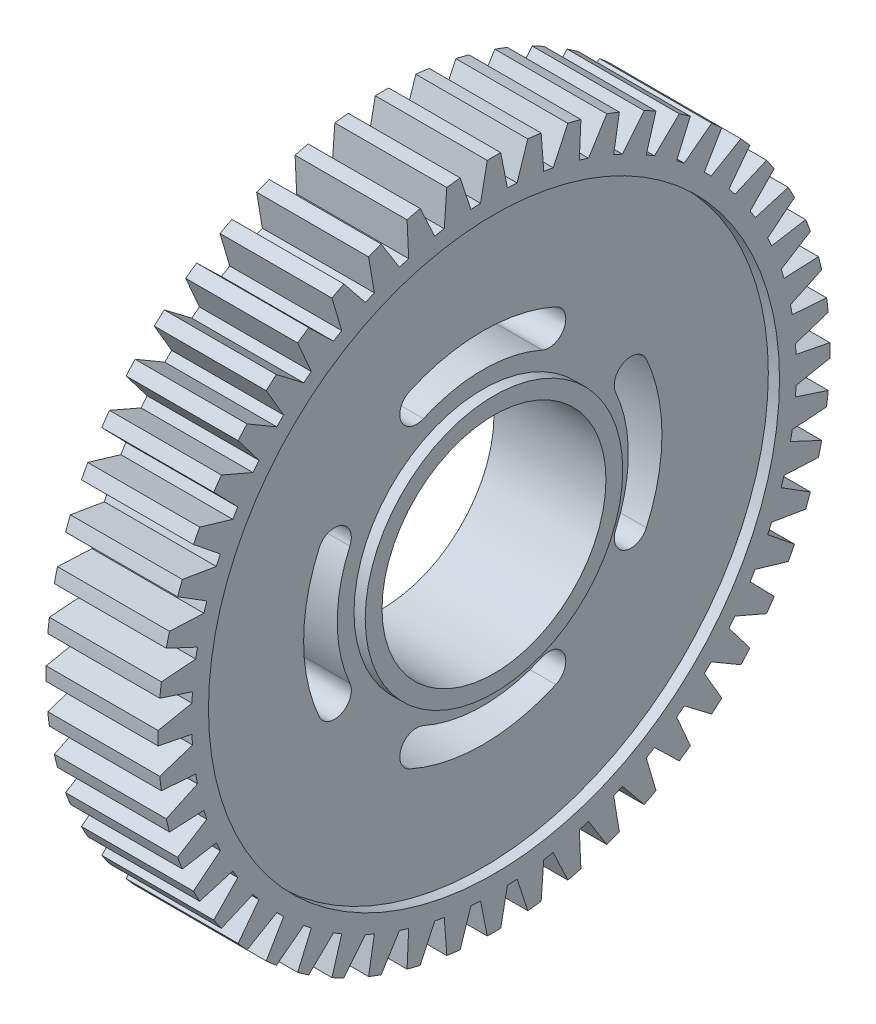
from build123d import *

# Parameters (mm, degrees)
SKETCH1_R           = 27
SKETCH1_R_2         = 11.5
BOSS_EXTRUDE1_DEPTH = 4
SKETCH1_3_R         = 27
SKETCH1_3_R_2       = 25.5
SKETCH1_3_R_3       = 11.5
SKETCH1_3_R_4       = 10
BOSS_EXTRUDE2_DEPTH = 5
BOSS_EXTRUDE3_DEPTH = 5
CIRPATTERN1_COUNT   = 52
CUT_EXTRUDE2_DEPTH  = 43.720018727
FILLET1_START       = -4
FILLET1_DEPTH       = 8
FILLET2_START       = -4
FILLET2_DEPTH       = 8
CIRPATTERN2_COUNT   = 4


with BuildPart() as part:
    # Sketch1 → Boss-Extrude1 (new, symmetric)
    with BuildSketch(Plane.YZ):
        with Locations(Location((0, 0, 0), (0, 0, 270))):
            Circle(SKETCH1_R)
        with Locations(Location((0, 0, 0), (0, 0, 270))):
            Circle(SKETCH1_R_2, mode=Mode.SUBTRACT)
    extrude(amount=BOSS_EXTRUDE1_DEPTH, both=True)

    # Sketch1<3> → Boss-Extrude2 (add, symmetric)
    # profile 1 of 2: a face of its own
    with BuildSketch(Plane.YZ):
        with Locations(Location((0, 0, 0), (0, 0, 270))):
            Circle(SKETCH1_3_R)
        with Locations(Location((0, 0, 0), (0, 0, 270))):
            Circle(SKETCH1_3_R_2, mode=Mode.SUBTRACT)
    # profile 2 of 2: a face of its own
    with BuildSketch(Plane.YZ):
        with Locations(Location((0, 0, 0), (0, 0, 270))):
            Circle(SKETCH1_3_R_3)
        with Locations(Location((0, 0, 0), (0, 0, 270))):
            Circle(SKETCH1_3_R_4, mode=Mode.SUBTRACT)
    extrude(amount=BOSS_EXTRUDE2_DEPTH, both=True)

    # Sketch1<4> → Boss-Extrude3 (add, symmetric)
    with BuildSketch(Plane.YZ):
        with BuildLine():
            ThreePointArc((29.993975486, -0.601194282), (29.998493834, -0.300612233), (30, 0))
            ThreePointArc((30, 0), (29.998493834, 0.300612233), (29.993975486, 0.601194282))
            Line((29.993975486, 0.601194282), (26.973320152, 1.2))
            ThreePointArc((26.973320152, 1.2), (26.993329214, 0.600148276), (27, 0))
            ThreePointArc((27, 0), (26.993329214, -0.600148276), (26.973320152, -1.2))
            Line((26.973320152, -1.2), (29.993975486, -0.601194282))
        make_face()
    boss_extrude3 = extrude(amount=BOSS_EXTRUDE3_DEPTH, both=True)

    # CirPattern1: Boss-Extrude3 ×52 about axis
    cirpattern1_axis = Axis((0, 0, 0), (1, 0, 0))
    for i in range(1, CIRPATTERN1_COUNT):
        add(boss_extrude3.rotate(cirpattern1_axis, i * 360 / CIRPATTERN1_COUNT))

    # Sketch1<6> → Cut-Extrude2 (cut, symmetric)
    with BuildSketch(Plane.YZ):
        with BuildLine():
            ThreePointArc((-6.5, 11.258330249), (0, 13), (6.5, 11.258330249))
            Line((6.5, 11.258330249), (8, 13.856406461))
            ThreePointArc((8, 13.856406461), (0, 16), (-8, 13.856406461))
            Line((-8, 13.856406461), (-6.5, 11.258330249))
        make_face()
    cut_extrude2 = extrude(amount=CUT_EXTRUDE2_DEPTH, both=True, mode=Mode.SUBTRACT)

    # Fillet1: read off the stored shape, not the designer's step
    # Fillet1 outline → Fillet1 (add)
    with BuildSketch(Plane.YZ.offset(FILLET1_START)):
        with BuildLine():
            ThreePointArc((-6.5, 11.258330249), (-5.908165679, 11.579878165), (-5.300471571, 11.870341239))
            add(Edge.make_bspline(
                [(-5.300471571, 11.870341239), (-5.62097103, 11.727228396), (-6.029597703, 11.655683844), (-6.496578351, 11.727639411), (-6.932882302, 12.008104397), (-7.211102546, 12.489995989)],
                knots=[0, 0, 0, 0, 0, 0, 0.474068366, 0.474068366, 0.474068366, 0.474068366, 0.474068366, 0.474068366], degree=5, weights=[1, 0.810372654, 0.66569347, 0.56596245, 0.511179593, 0.501344899]))
            Line((-7.211102546, 12.489995989), (-6.5, 11.258330249))
        make_face()
        with BuildLine():
            Line((-8, 13.856406461), (-7.211102546, 12.489995989))
            add(Edge.make_bspline(
                [(-7.211102546, 12.489995989), (-7.532816375, 13.047220679), (-7.525071781, 13.652742597), (-7.259064797, 14.138057651), (-6.888560975, 14.446710077), (-6.523657318, 14.609650755)],
                knots=[0.474068366, 0.474068366, 0.474068366, 0.474068366, 0.474068366, 0.474068366, 1, 1, 1, 1, 1, 1], degree=5, weights=[0.501344899, 0.490434286, 0.534844489, 0.634575509, 0.789627346, 1]))
            ThreePointArc((-6.523657318, 14.609650755), (-7.271588528, 14.252157742), (-8, 13.856406461))
        make_face()
    fillet1 = extrude(amount=FILLET1_DEPTH)

    # Fillet2: read off the stored shape, not the designer's step
    # Fillet2 outline → Fillet2 (add)
    with BuildSketch(Plane.YZ.offset(FILLET2_START)):
        with BuildLine():
            ThreePointArc((8, 13.856406461), (7.271588528, 14.252157742), (6.523657319, 14.609650756))
            add(Edge.make_bspline(
                [(6.523657319, 14.609650756), (6.888562857, 14.446709236), (7.259068551, 14.138054524), (7.525075636, 13.652735564), (7.532816513, 13.047209924), (7.21109614, 12.489984893)],
                knots=[0, 0, 0, 0, 0, 0, 0.525933775, 0.525933775, 0.525933775, 0.525933775, 0.525933775, 0.525933775], degree=5, weights=[1, 0.78962649, 0.634574247, 0.534843271, 0.490433563, 0.501345121]))
            Line((7.21109614, 12.489984893), (8, 13.856406461))
        make_face()
        with BuildLine():
            Line((6.5, 11.258330249), (7.21109614, 12.489984893))
            add(Edge.make_bspline(
                [(7.21109614, 12.489984893), (6.932873575, 12.008098787), (6.496570908, 11.727638264), (6.02959321, 11.655684631), (5.620969244, 11.727229194), (5.300471572, 11.870341239)],
                knots=[0.525933775, 0.525933775, 0.525933775, 0.525933775, 0.525933775, 0.525933775, 1, 1, 1, 1, 1, 1], degree=5, weights=[0.501345121, 0.511180583, 0.565963802, 0.665694777, 0.81037351, 1]))
            ThreePointArc((5.300471572, 11.870341239), (5.908165679, 11.579878165), (6.5, 11.258330249))
        make_face()
    fillet2 = extrude(amount=FILLET2_DEPTH)

    # CirPattern2: Cut-Extrude2, Fillet1, Fillet2 ×4 about axis
    cirpattern2_axis = Axis((4, 0, 0), (1, 0, 0))
    add([cut_extrude2.rotate(cirpattern2_axis, i * 360 / CIRPATTERN2_COUNT) for i in range(1, CIRPATTERN2_COUNT)], mode=Mode.SUBTRACT)
    add([fillet1.rotate(cirpattern2_axis, i * 360 / CIRPATTERN2_COUNT) for i in range(1, CIRPATTERN2_COUNT)])
    add([fillet2.rotate(cirpattern2_axis, i * 360 / CIRPATTERN2_COUNT) for i in range(1, CIRPATTERN2_COUNT)])


solid = part.part
